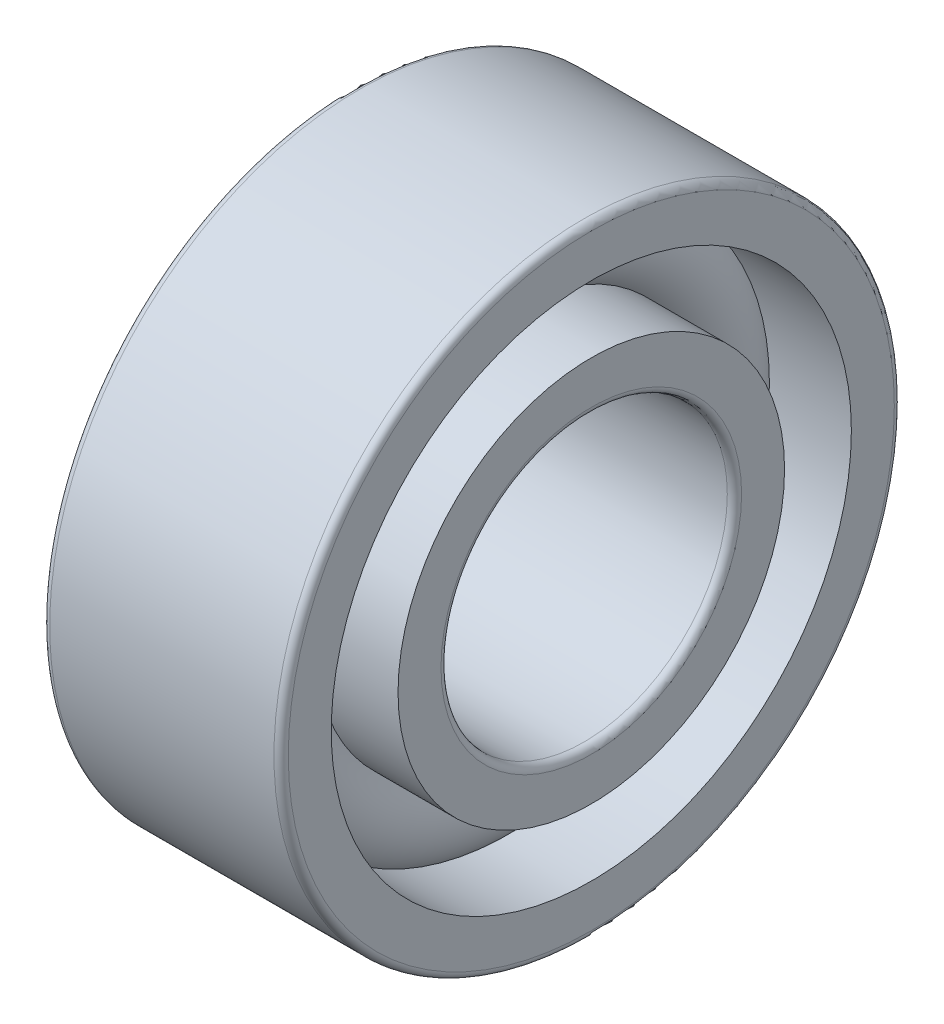
from build123d import *

# Parameters (mm, degrees)
CAGSPISKE_W     = 0.21
CAGSPISKE_H     = 0.35
CAGESPINE_ANGLE = 0.001
BALSIMSKE_R     = 1.05


with BuildPart() as part:
    # CagSpiSke → CageSpine (revolve)
    with BuildSketch(Plane.XY):
        with Locations((0, 4.75)):
            Rectangle(CAGSPISKE_W, CAGSPISKE_H)
    revolve(axis=Axis((-20.6375, 0, 0), (-1, 0, 0)), revolution_arc=CAGESPINE_ANGLE)

    # BalSimSke → BallsSimplified (revolve)
    with BuildSketch(Plane.XY):
        with Locations((0, 4.75)):
            Circle(BALSIMSKE_R)
    revolve(axis=Axis((-10, 0, 0), (1, 0, 0)))

    # InnRacSke → InnerRace (revolve)
    with BuildSketch(Plane.XY):
        with BuildLine():
            Line((-0.748748957, 4.05), (-2.5, 4.05))
            Line((-2.5, 4.05), (-2.5, 3.15))
            ThreePointArc((-2.5, 3.15), (-2.456066017, 3.043933983), (-2.35, 3))
            Line((-2.35, 3), (2.35, 3))
            ThreePointArc((2.35, 3), (2.456066017, 3.043933983), (2.5, 3.15))
            Line((2.5, 3.15), (2.5, 4.05))
            Line((2.5, 4.05), (0.748748957, 4.05))
            ThreePointArc((0.748748957, 4.05), (0, 3.725), (-0.748748957, 4.05))
        make_face()
    revolve(axis=Axis((-20.6375, 0, 0), (1, 0, 0)))

    # OutRacSke → OuterRace (revolve)
    with BuildSketch(Plane.XY):
        with BuildLine():
            Line((-0.748748957, 5.45), (-2.5, 5.45))
            Line((-2.5, 5.45), (-2.5, 6.35))
            ThreePointArc((-2.5, 6.35), (-2.456066017, 6.456066017), (-2.35, 6.5))
            Line((-2.35, 6.5), (2.35, 6.5))
            ThreePointArc((2.35, 6.5), (2.456066017, 6.456066017), (2.5, 6.35))
            Line((2.5, 6.35), (2.5, 5.45))
            Line((2.5, 5.45), (0.748748957, 5.45))
            ThreePointArc((0.748748957, 5.45), (0, 5.775), (-0.748748957, 5.45))
        make_face()
    revolve(axis=Axis((-20.6375, 0, 0), (1, 0, 0)))


solid = part.part
